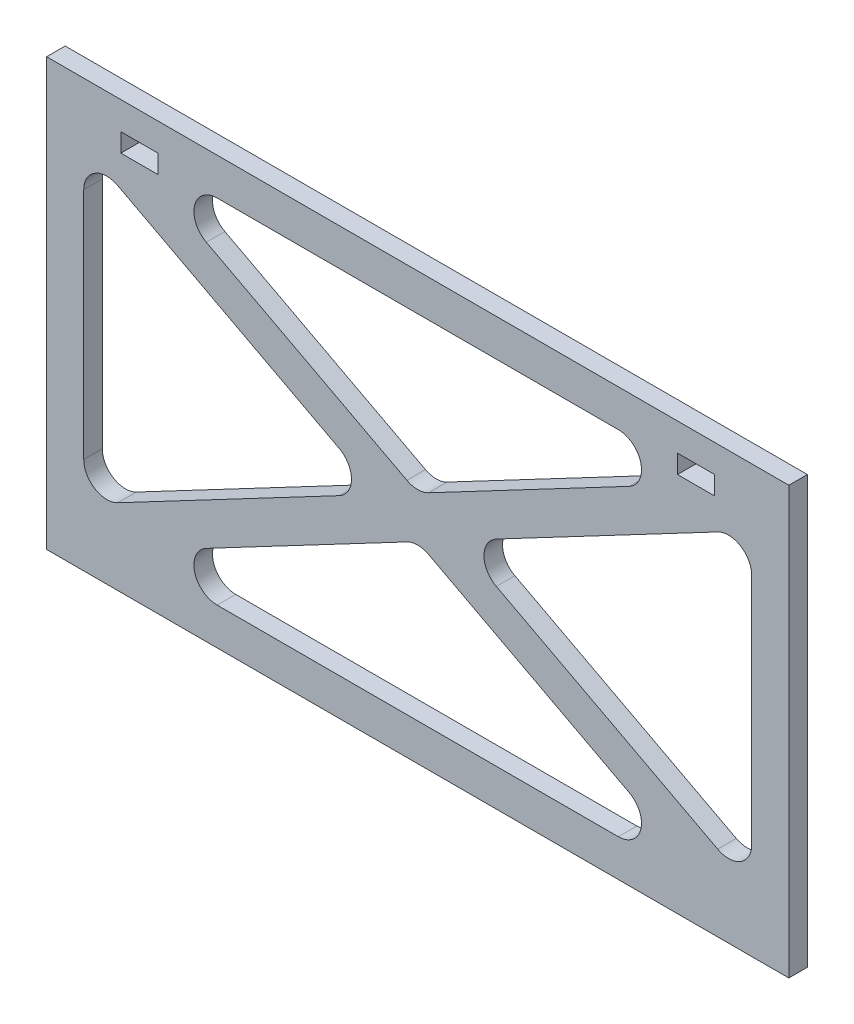
from build123d import *

# Parameters (mm, degrees)
SKETCH1_W               = 203.2
SKETCH1_H               = 116.84
BOSS_EXTRUDE1_DEPTH     = 5.08
FILLET1_R               = 6.35
CUT_EXTRUDE1_DEPTH      = 118.308408906
CUT_EXTRUDE1_DEPTH_BACK = 118.308408906
SKETCH2_W               = 10.16
SKETCH2_H               = 5.08


with BuildPart() as part:
    # Sketch1 → Boss-Extrude1 (new body)
    with BuildSketch(Plane.XY):
        Rectangle(SKETCH1_W, SKETCH1_H)
        Polygon((10.883569766, 0), (91.44, 42.515893734), (91.44, -42.515893734), align=None, mode=Mode.SUBTRACT)
        Polygon((80.556430234, 48.26), (0, 5.744106266), (-80.556430234, 48.26), align=None, mode=Mode.SUBTRACT)
        Polygon((-91.44, -42.515893734), (-91.44, 42.515893734), (-10.883569766, 0), align=None, mode=Mode.SUBTRACT)
        Polygon((80.556430234, -48.26), (-80.556430234, -48.26), (0, -5.744106266), align=None, mode=Mode.SUBTRACT)
    extrude(amount=BOSS_EXTRUDE1_DEPTH)

    # Fillet1
    fillet1_edges = [part.edges().sort_by_distance(p)[0] for p in [
        (10.883569766, 0, 2.54),
        (91.44, -42.515893734, 2.54),
        (80.556430234, -48.26, 2.54),
        (-80.556430234, -48.26, 2.54),
        (91.44, 42.515893734, 2.54),
        (80.556430234, 48.26, 2.54),
        (-80.556430234, 48.26, 2.54),
        (0, -5.744106266, 2.54),
        (-10.883569766, 0, 2.54),
        (0, 5.744106266, 2.54),
        (-91.44, -42.515893734, 2.54),
        (-91.44, 42.515893734, 2.54),
    ]]
    fillet(fillet1_edges, radius=FILLET1_R)

    # Sketch2 → Cut-Extrude1 (cut, two sides: drawn at the far end of the back side and taken through both)
    with BuildSketch(Plane.XY.offset(5.08).offset(-CUT_EXTRUDE1_DEPTH_BACK)):
        with Locations((-76.2, 48.26)):
            Rectangle(SKETCH2_W, SKETCH2_H)
        with Locations((76.2, 48.26)):
            Rectangle(SKETCH2_W, SKETCH2_H)
    extrude(amount=CUT_EXTRUDE1_DEPTH + CUT_EXTRUDE1_DEPTH_BACK, mode=Mode.SUBTRACT)


solid = part.part
